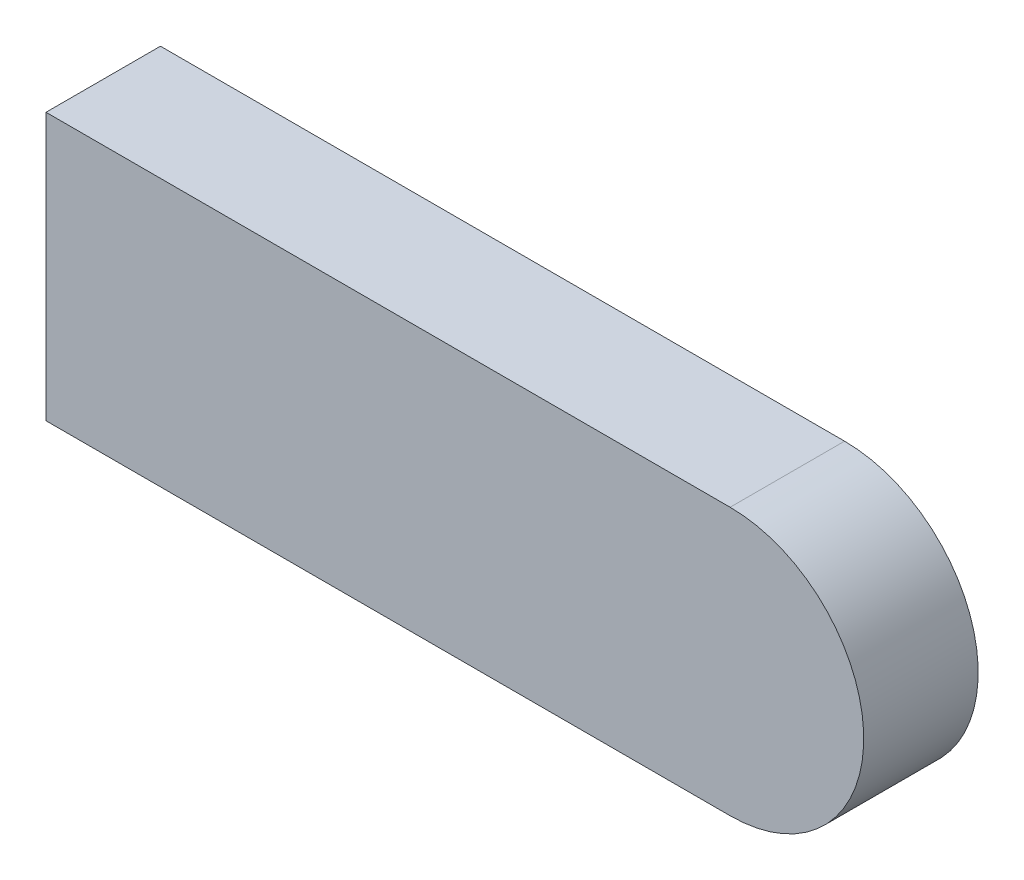
from build123d import *

# Parameters (mm, degrees)
BOSS_EXTRUDE2_DEPTH = 30


with BuildPart() as part:
    # Sketch1 → Boss-Extrude2 (new body)
    with BuildSketch(Plane.XY):
        with BuildLine():
            Line((1447.388499604, 2050.24550477), (1268.06152152, 2050.24550477))
            Line((1268.06152152, 2050.24550477), (1268.06152152, 1980.20877571))
            Line((1268.06152152, 1980.20877571), (1447.388499604, 1980.20877571))
            ThreePointArc((1447.388499604, 1980.20877571), (1482.406864134, 2015.22714024), (1447.388499604, 2050.24550477))
        make_face()
    extrude(amount=BOSS_EXTRUDE2_DEPTH)


solid = part.part
